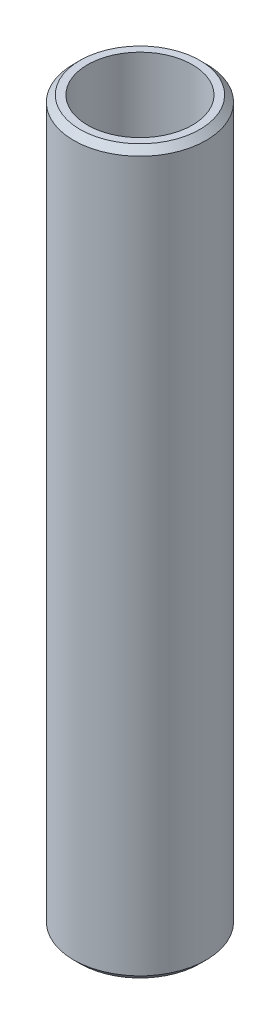
from build123d import *

# Parameters (mm, degrees)
SKETCH1_R           = 55
BOSS_EXTRUDE1_DEPTH = 600
SKETCH2_R           = 43.517066073
CUT_EXTRUDE1_DEPTH  = 606.020660804
CHAMFER1_SIZE       = 5.261774463


with BuildPart() as part:
    # Sketch1 → Boss-Extrude1 (new body)
    with BuildSketch(Plane(origin=(0, 0, 0), x_dir=(1, 0, 0), z_dir=(0, 1, 0))):
        Circle(SKETCH1_R)
    extrude(amount=BOSS_EXTRUDE1_DEPTH)

    # Sketch2 → Cut-Extrude1 (cut, through all)
    with BuildSketch(Plane(origin=(0, 0, 0), x_dir=(1, 0, 0), z_dir=(0, 1, 0))):
        Circle(SKETCH2_R)
    extrude(amount=CUT_EXTRUDE1_DEPTH, mode=Mode.SUBTRACT)

    # Chamfer1
    chamfer1_edges = [part.edges().sort_by_distance(p)[0] for p in [
        (-55, 600, 0),
        (-55, 0, 0),
    ]]
    chamfer(chamfer1_edges, length=CHAMFER1_SIZE)


solid = part.part
